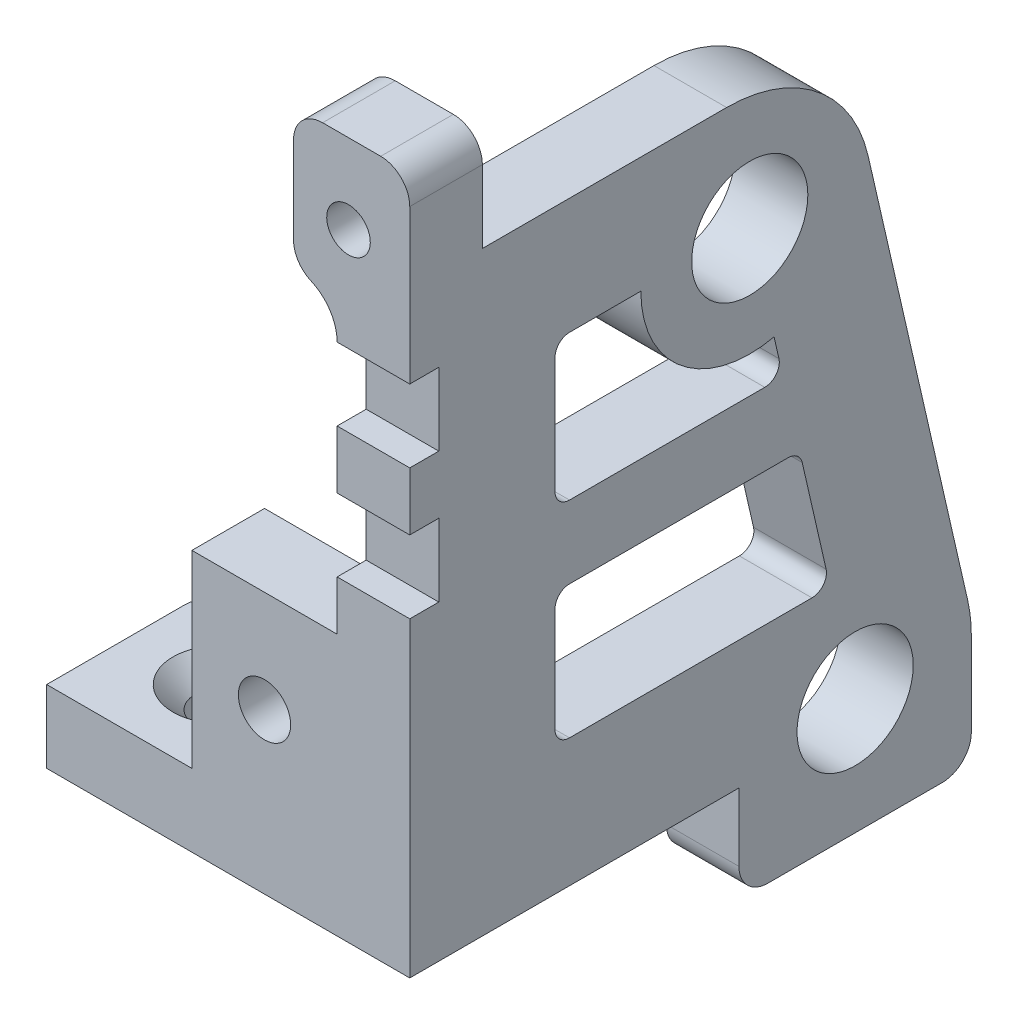
from build123d import *

# Parameters (mm, degrees)
SKETCH_1_R                = 4
EXTRUDE_1_DEPTH           = 5
EXTRUDE_2_DEPTH           = 10
FILLET_1_R                = 10
EXTRUDE_3_DEPTH           = 7
EXTRUDE_3_DEPTH_BACK      = 3
SKETCH_7_W                = 8
SKETCH_7_H                = 5
HOLE_WIZARD_1_D           = 3.6
HOLE_WIZARD_1_CSINK_D     = 6.6
HOLE_WIZARD_1_CSINK_ANGLE = 90
FILLET_2_R                = 2
FILLET_3_R                = 3
MM_TRANSITIONAL_1_D       = 3
SKETCH_10_W               = 2
SKETCH_10_H               = 5
CUT_EXTRUDE_1_DEPTH       = 48.143222787
SKETCH_11_W               = 11.5
SKETCH_11_H               = 5
EXTRUDE_4_DEPTH           = 10
HOLE_WIZARD_2_D           = 3.6
HOLE_WIZARD_2_CSINK_D     = 6.6
HOLE_WIZARD_2_CSINK_ANGLE = 90
CUT_EXTRUDE_2_DEPTH       = 51.224331302
FILLET_5_R                = 1
FILLET_6_R                = 2
SKETCH_13_W               = 3.5
SKETCH_13_H               = 5
CUT_EXTRUDE_3_DEPTH       = 0.5


with BuildPart() as part:
    # 草图1 → 凸台-拉伸1 (new body)
    with BuildSketch(Plane(origin=(0, 0, 0), x_dir=(0, 0, -1), z_dir=(1, 0, 0))):
        Polygon((-23.41, -33), (-0.742923434, -33), (-0.742923434, -39.679407187), (15.257076566, -39.679407187), (15.257076566, -30.774808421), (6.3745949, 8), (-23.41, 8), align=None)
        Circle(SKETCH_1_R, mode=Mode.SUBTRACT)
        with Locations((7.257076566, -31.679407187)):
            Circle(SKETCH_1_R, mode=Mode.SUBTRACT)
    extrude(amount=EXTRUDE_1_DEPTH)

    # 草图2 → 凸台-拉伸2 (add)
    with BuildSketch(Plane.ZY):
        Polygon((23.41, -15), (23.41, -33), (11.91, -33), (11.91, -28), (18.41, -28), (18.41, -15), align=None)
    extrude(amount=EXTRUDE_2_DEPTH)

    # 圆角1
    fillet_1_edges = [part.edges().sort_by_distance(p)[0] for p in [
        (2.5, 8, -6.3745949),
        (2.5, -30.774808421, -15.257076566),
    ]]
    fillet(fillet_1_edges, radius=FILLET_1_R)

    # 草图7 → 凸台-拉伸3 (add, two sides: drawn at the far end of the back side and taken through both)
    with BuildSketch(Plane(origin=(0, 8, 0), x_dir=(1, 0, 0), z_dir=(0, 1, 0)).offset(-EXTRUDE_3_DEPTH_BACK)):
        with Locations((1, -20.91)):
            Rectangle(SKETCH_7_W, SKETCH_7_H)
    extrude(amount=EXTRUDE_3_DEPTH + EXTRUDE_3_DEPTH_BACK)

    # 打孔尺寸(%根据十字)槽半沉头木螺钉的类型1 (through all)
    with Locations(Plane(origin=(0, 0, 18.41), x_dir=(-1, 0, 0), z_dir=(0, 0, -1))):
        with Locations((5, -22)):
            CounterSinkHole(HOLE_WIZARD_1_D / 2, HOLE_WIZARD_1_CSINK_D / 2, counter_sink_angle=HOLE_WIZARD_1_CSINK_ANGLE)

    # 圆角2
    fillet_2_edges = [part.edges().sort_by_distance(p)[0] for p in [
        (2.5, -39.679407187, 0.742923434),
        (2.5, -39.679407187, -15.257076566),
        (-3, 5, 20.91),
        (5, 15, 20.91),
        (-3, 15, 20.91),
    ]]
    fillet(fillet_2_edges, radius=FILLET_2_R)

    # 圆角3
    # the kernel refuses this fillet: 3 mm, written as the material it adds along each edge
    with BuildSketch(Plane(origin=(0, 5, 23.41), x_dir=(0, -1, 0), z_dir=(0, 0, -1))) as fillet_3_piece_1:
        with BuildLine():
            CenterArc((2.582575695, 3), FILLET_3_R, 203.578178478, 66.421821522)
            Line((-0.166969722, 1.8), (-0.441924264, 1.68))
            ThreePointArc((-0.441924264, 1.68), (-0.3, 1), (-0.3, 0))
            Line((-0.3, 0), (0, -0.3))
            Line((0, -0.3), (2.582575695, -0.3))
            Line((2.582575695, -0.3), (2.582575695, 0))
        make_face()
    extrude(amount=5)

    # 大小mm Transitional 暗销孔1 (through all)
    with Locations(Plane(origin=(0, 0, 18.41), x_dir=(-1, 0, 0), z_dir=(0, 0, -1))):
        with Locations((-0.78249385, 9.508910889)):
            Hole(MM_TRANSITIONAL_1_D / 2)

    # 草图10 → 切除-拉伸1 (cut, through all)
    with BuildSketch(Plane.ZY):
        with Locations((22.41, -0.082575695)):
            Rectangle(SKETCH_10_W, SKETCH_10_H)
        with Locations((22.41, -9.082575695)):
            Rectangle(SKETCH_10_W, SKETCH_10_H)
    extrude(amount=-CUT_EXTRUDE_1_DEPTH, mode=Mode.SUBTRACT)

    # 草图11 → 凸台-拉伸4 (add)
    with BuildSketch(Plane.ZY.offset(10)):
        with Locations((17.66, -30.5)):
            Rectangle(SKETCH_11_W, SKETCH_11_H)
    extrude(amount=EXTRUDE_4_DEPTH)

    # 打孔尺寸(%根据十字)槽半沉头木螺钉的类型2 (through all)
    with Locations(Plane(origin=(0, -28, 0), x_dir=(1, 0, 0), z_dir=(0, 1, 0))):
        with Locations((-14, -17.41)):
            CounterSinkHole(HOLE_WIZARD_2_D / 2, HOLE_WIZARD_2_CSINK_D / 2, counter_sink_angle=HOLE_WIZARD_2_CSINK_ANGLE)

    # 草图12 → 切除-拉伸2 (cut, through all)
    with BuildSketch(Plane.ZY):
        with BuildLine():
            Line((7.5, 0), (13.41, 0))
            Line((13.41, 0), (13.41, -10))
            Line((13.41, -10), (-2.290786732, -10))
            Line((-2.290786732, -10), (-1.674709977, -7.310632428))
            ThreePointArc((-1.674709977, -7.310632428), (4.673846124, -5.865591395), (7.5, 0))
        make_face()
        Polygon((-5.538986517, -24.179407187), (13.41, -24.179407187), (13.41, -15), (-3.436180098, -15), align=None)
    extrude(amount=-CUT_EXTRUDE_2_DEPTH, mode=Mode.SUBTRACT)

    # 圆角5
    fillet_5_edges = [part.edges().sort_by_distance(p)[0] for p in [
        (2.5, 0, 13.41),
        (2.5, -10, 13.41),
        (2.5, -10, -2.290786732),
        (2.5, -24.179407187, -5.538986517),
        (2.5, -15, -3.436180098),
        (2.5, -15, 13.41),
        (2.5, -24.179407187, 13.41),
    ]]
    fillet(fillet_5_edges, radius=FILLET_5_R)

    # 圆角6
    fillet_6_edges = [part.edges().sort_by_distance(p)[0] for p in [
        (-20, -30.5, 11.91),
    ]]
    fillet(fillet_6_edges, radius=FILLET_6_R)

    # 草图13 → 切除-拉伸3 (cut)
    with BuildSketch(Plane.XZ.offset(33)):
        with Locations((-18.25, 14.41)):
            Rectangle(SKETCH_13_W, SKETCH_13_H)
    extrude(amount=-CUT_EXTRUDE_3_DEPTH, mode=Mode.SUBTRACT)


solid = part.part
